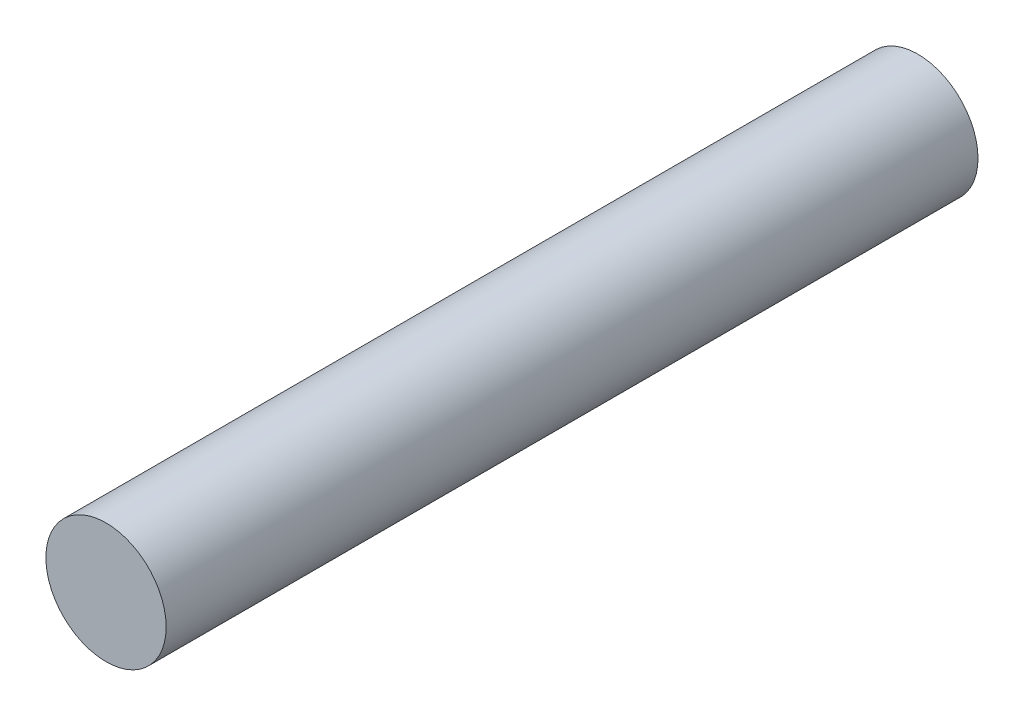
from build123d import *

# Parameters (mm, degrees)
SKETCH1_R           = 25.4
BOSS_EXTRUDE1_DEPTH = 342.9


with BuildPart() as part:
    # Sketch1 → Boss-Extrude1 (new body)
    with BuildSketch(Plane.XY):
        Circle(SKETCH1_R)
    extrude(amount=BOSS_EXTRUDE1_DEPTH)


solid = part.part
